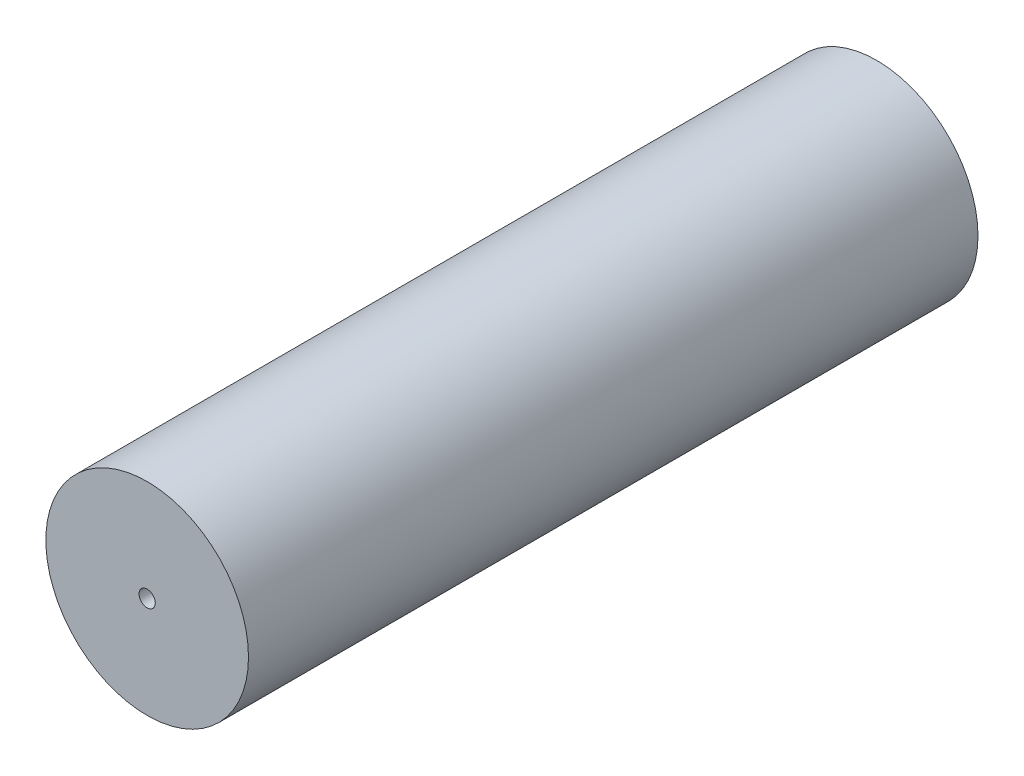
from build123d import *

# Parameters (mm, degrees)
SKETCH1_R           = 125
BOSS_EXTRUDE1_DEPTH = 900
SKETCH2_R           = 10
CUT_EXTRUDE1_DEPTH  = 200
CUT_EXTRUDE2_START  = -200
SKETCH3_R           = 10
CUT_EXTRUDE2_DEPTH  = 200


with BuildPart() as part:
    # Sketch1 → Boss-Extrude1 (new body)
    with BuildSketch(Plane.XY):
        Circle(SKETCH1_R)
    extrude(amount=BOSS_EXTRUDE1_DEPTH)

    # Sketch2 → Cut-Extrude1 (cut)
    with BuildSketch(Plane.XY.offset(900)):
        Circle(SKETCH2_R)
    extrude(amount=-CUT_EXTRUDE1_DEPTH, mode=Mode.SUBTRACT)

    # Sketch3 → Cut-Extrude2 (cut)
    with BuildSketch(Plane(origin=(0, 0, 0), x_dir=(-1, 0, 0), z_dir=(0, 0, -1)).offset(CUT_EXTRUDE2_START)):
        Circle(SKETCH3_R)
    extrude(amount=CUT_EXTRUDE2_DEPTH, mode=Mode.SUBTRACT)


solid = part.part
